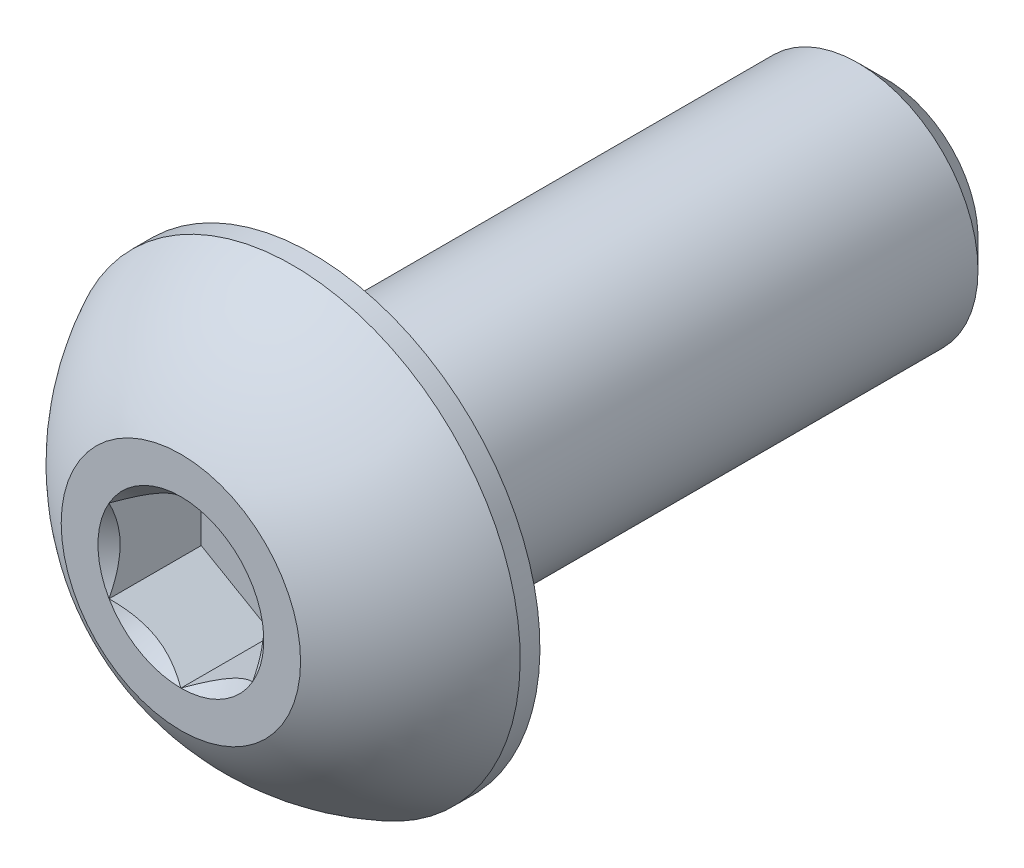
from build123d import *

# Parameters (mm, degrees)
CUT_EXTRUDE2_DEPTH = 1.925


with BuildPart() as part:
    # Sketch10 → Revolve3 (revolve)
    with BuildSketch(Plane(origin=(0, 0, 0), x_dir=(0, 0, -1), z_dir=(1, 0, 0))):
        Polygon((5.4, 2.5), (6, 1.9), (6, 0), (-6, 0), (-6, 2.5), align=None)
    revolve(axis=Axis((0, 0, 8.75), (0, 0, -1)))

    # Sketch7 → Revolve2 (revolve)
    with BuildSketch(Plane(origin=(0, 0, 0), x_dir=(0, 0, -1), z_dir=(1, 0, 0))):
        with BuildLine():
            Line((-6.4125, 4.75), (-6, 4.75))
            Line((-6, 4.75), (-6, 0))
            Line((-6, 0), (-8.75, 0))
            Line((-8.75, 0), (-8.75, 2.5))
            ThreePointArc((-8.75, 2.5), (-7.758124817, 3.808753282), (-6.4125, 4.75))
        make_face()
    revolve(axis=Axis((0, 0, 8.75), (0, 0, -1)))

    # Sketch5 → Cut-Extrude2 (cut)
    with BuildSketch(Plane.XY.offset(8.75)):
        Polygon((1.5, -0.866025404), (1.5, 0.866025404), (0, 1.732050808), (-1.5, 0.866025404), (-1.5, -0.866025404), (0, -1.732050808), align=None)
    extrude(amount=-CUT_EXTRUDE2_DEPTH, mode=Mode.SUBTRACT)

    # Cut-Extrude3 cone 1 section (through the dimple's axis) → Cut-Extrude3 (revolve, cut)
    with BuildSketch(Plane(origin=(0, 0, 8.75), x_dir=(0, -1, 0), z_dir=(1, 0, 0))):
        Polygon((0, 0), (1.732050808, 0), (0, 1.732050808), align=None)
    revolve(axis=Axis((0, 0, 8.75), (0, 0, -1)), mode=Mode.SUBTRACT)


solid = part.part
